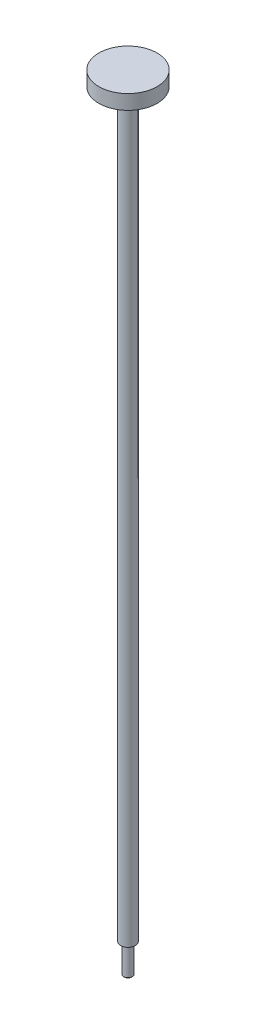
from build123d import *

# Parameters (mm, degrees)
SKETCH1_R           = 2.5
BOSS_EXTRUDE1_DEPTH = 254
SKETCH2_R           = 2
BOSS_EXTRUDE2_DEPTH = 10
SKETCH4_R           = 10
BOSS_EXTRUDE3_DEPTH = 5


# Read off the part's stored shape, not the designer's step: M3 Machine Threads Stud1
with BuildPart() as part:
    # Sketch1 → Boss-Extrude1 (new body)
    with BuildSketch(Plane(origin=(0, 0, 0), x_dir=(1, 0, 0), z_dir=(0, 1, 0))):
        with Locations(Location((0, 0, 0), (0, 0, 270))):
            Circle(SKETCH1_R)
    extrude(amount=BOSS_EXTRUDE1_DEPTH)

    # Sketch2 → Boss-Extrude2 (add)
    with BuildSketch(Plane.XZ):
        with Locations(Location((0, 0, 0), (0, 0, 270))):
            Circle(SKETCH2_R)
    extrude(amount=BOSS_EXTRUDE2_DEPTH)

    # M3 Machine Threads Stud1 outline → M3 Machine Threads Stud1 (revolve, cut)
    with BuildSketch(Plane.XY):
        Polygon((2, 0), (1.5, 0), (1.5, -9.7195), (1.2195, -10), (2, -10), align=None)
    revolve(axis=Axis((0, 0, 0), (0, 1, 0)), mode=Mode.SUBTRACT)

    # Sketch4 → Boss-Extrude3 (add)
    with BuildSketch(Plane(origin=(0, 254, 0), x_dir=(1, 0, 0), z_dir=(0, 1, 0))):
        with Locations(Location((0, 0, 0), (0, 0, 270))):
            Circle(SKETCH4_R)
    extrude(amount=BOSS_EXTRUDE3_DEPTH)


solid = part.part
